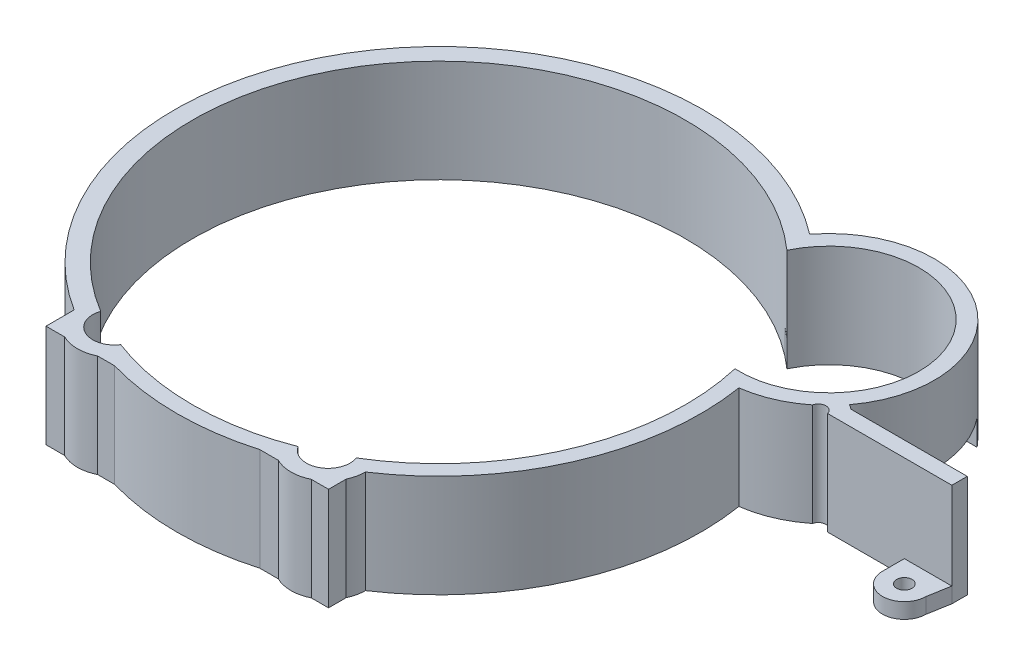
from build123d import *
from build123d.topology import SkipClean

# Parameters (mm, degrees)
CROQUIS1_R               = 51
CROQUIS1_R_2             = 48
SALIENTE_EXTRUIR1_DEPTH  = 20
CROQUIS2_W               = 46.227664069
CROQUIS2_H               = 115.031629194
CORTAR_EXTRUIR1_DEPTH    = 20
CROQUIS3_W               = 115.031629194
CROQUIS3_H               = 50
CORTAR_EXTRUIR2_DEPTH    = 20
CROQUIS4_R               = 20.5
CROQUIS4_R_2             = 17.5
SALIENTE_EXTRUIR2_DEPTH  = 20
CROQUIS5_W               = 28.18
CROQUIS5_H               = 3
SALIENTE_EXTRUIR3_DEPTH  = 20
CROQUIS6_W               = 111.479802907
CROQUIS6_H               = 36.253594441
CORTAR_EXTRUIR3_DEPTH    = 20
CORTAR_EXTRUIR4_START    = -20
CROQUIS7_R               = 48
CORTAR_EXTRUIR4_DEPTH    = 20
CROQUIS8_R               = 4.25
CORTAR_EXTRUIR5_DEPTH    = 20
CROQUIS9_R               = 7.25
CROQUIS9_R_2             = 4.25
SALIENTE_EXTRUIR4_DEPTH  = 20
CROQUIS10_W              = 2.531492225
CROQUIS10_H              = 7.290281387
CORTAR_EXTRUIR6_DEPTH    = 20
CROQUIS11_R              = 48
CORTAR_EXTRUIR7_DEPTH    = 20
SALIENTE_EXTRUIR5_DEPTH  = 3
CROQUIS13_R              = 4.25
CROQUIS13_R_2            = 2.5
SALIENTE_EXTRUIR6_DEPTH  = 3
CROQUIS14_R              = 2.5
CORTAR_EXTRUIR8_DEPTH    = 3
CROQUIS16_R              = 4.25
CORTAR_EXTRUIR9_DEPTH    = 20
CROQUIS17_R              = 7.25
CROQUIS17_R_2            = 4.25
SALIENTE_EXTRUIR7_DEPTH  = 20
CROQUIS18_R              = 48
CORTAR_EXTRUIR10_DEPTH   = 20
CROQUIS19_R              = 4.25
CROQUIS19_R_2            = 2.5
SALIENTE_EXTRUIR8_DEPTH  = 3
CROQUIS20_R              = 4.25
CROQUIS20_R_2            = 2.5
SALIENTE_EXTRUIR9_DEPTH  = 3
CROQUIS21_R              = 4.25
CROQUIS21_R_2            = 2.5
SALIENTE_EXTRUIR10_DEPTH = 3
SALIENTE_EXTRUIR11_DEPTH = 3
CROQUIS24_R              = 1.5
CORTAR_EXTRUIR12_DEPTH   = 20
SALIENTE_EXTRUIR12_DEPTH = 20
CROQUIS26_W              = 2.889817697
CROQUIS26_H              = 4.125131583
SALIENTE_EXTRUIR16_DEPTH = 20
CROQUIS29_W              = 44.739591713
CROQUIS29_H              = 0.826618845
SALIENTE_EXTRUIR17_DEPTH = 20
CROQUIS30_W              = 3.358230928
CROQUIS30_H              = 3.6
SALIENTE_EXTRUIR18_DEPTH = 20
CROQUIS31_R              = 20.5
CROQUIS31_R_2            = 17.5
SALIENTE_EXTRUIR20_DEPTH = 15
CORTAR_EXTRUIR14_DEPTH   = 15
CROQUIS33_R              = 17.5
CORTAR_EXTRUIR16_DEPTH   = 30
CROQUIS34_R              = 1.5
CORTAR_EXTRUIR17_DEPTH   = 30
SALIENTE_EXTRUIR21_DEPTH = 5
SALIENTE_EXTRUIR23_DEPTH = 20
CROQUIS39_R              = 2.5
CROQUIS39_R_2            = 1.5
SALIENTE_EXTRUIR24_DEPTH = 3


with BuildPart() as part:
    # Croquis1 → Saliente-Extruir1 (new body)
    with BuildSketch(Plane(origin=(0, 0, 0), x_dir=(1, 0, 0), z_dir=(0, 1, 0))):
        Circle(CROQUIS1_R)
        Circle(CROQUIS1_R_2, mode=Mode.SUBTRACT)
    extrude(amount=SALIENTE_EXTRUIR1_DEPTH)

    # Croquis2 → Cortar-Extruir1 (cut)
    with BuildSketch(Plane(origin=(0, 20, 0), x_dir=(1, 0, 0), z_dir=(0, 1, 0))):
        with Locations((-50.613832034, -0.410683976)):
            Rectangle(CROQUIS2_W, CROQUIS2_H)
    extrude(amount=-CORTAR_EXTRUIR1_DEPTH, mode=Mode.SUBTRACT)

    # Croquis3 → Cortar-Extruir2 (cut)
    with BuildSketch(Plane(origin=(0, 20, 0), x_dir=(1, 0, 0), z_dir=(0, 1, 0))):
        with Locations((13.717810151, 36)):
            Rectangle(CROQUIS3_W, CROQUIS3_H)
    extrude(amount=-CORTAR_EXTRUIR2_DEPTH, mode=Mode.SUBTRACT)

    # Croquis4 → Saliente-Extruir2 (add)
    with BuildSketch(Plane(origin=(0, 20, 0), x_dir=(1, 0, 0), z_dir=(0, 1, 0))):
        with Locations((47.61, 28.36)):
            Circle(CROQUIS4_R)
        with Locations((47.61, 28.36)):
            Circle(CROQUIS4_R_2, mode=Mode.SUBTRACT)
    extrude(amount=-SALIENTE_EXTRUIR2_DEPTH)

    # Croquis5 → Saliente-Extruir3 (add)
    with BuildSketch(Plane(origin=(0, 20, 0), x_dir=(1, 0, 0), z_dir=(0, 1, 0))):
        with Locations((73.42, 13.86)):
            Rectangle(CROQUIS5_W, CROQUIS5_H)
    extrude(amount=-SALIENTE_EXTRUIR3_DEPTH)

    # Croquis6 → Cortar-Extruir3 (cut)
    with BuildSketch(Plane(origin=(0, 20, 0), x_dir=(1, 0, 0), z_dir=(0, 1, 0))):
        with Locations((72.258145343, 33.486797221)):
            Rectangle(CROQUIS6_W, CROQUIS6_H)
    extrude(amount=-CORTAR_EXTRUIR3_DEPTH, mode=Mode.SUBTRACT)

    # Croquis7 → Cortar-Extruir4 (cut)
    with BuildSketch(Plane(origin=(0, 20, 0), x_dir=(1, 0, 0), z_dir=(0, 1, 0)).offset(CORTAR_EXTRUIR4_START)):
        Circle(CROQUIS7_R)
    extrude(amount=CORTAR_EXTRUIR4_DEPTH, mode=Mode.SUBTRACT)

    # Croquis8 → Cortar-Extruir5 (cut)
    with BuildSketch(Plane(origin=(0, 20, 0), x_dir=(1, 0, 0), z_dir=(0, 1, 0))):
        with Locations((-20.65, -42.501453964)):
            Circle(CROQUIS8_R)
    extrude(amount=-CORTAR_EXTRUIR5_DEPTH, mode=Mode.SUBTRACT)


with BuildPart() as cortar_extruir5_piece_1:
    # of the separate pieces the step leaves, piece 1, a body of its own (cortar_extruir5_pieces)
    add(part.part.solids().sort_by_distance((-20.396323621, 0, 46.74387642))[0])



with BuildPart() as cortar_extruir5_piece_2:
    # of the separate pieces the step leaves, piece 2, a body of its own (cortar_extruir5_pieces)
    add(part.part.solids().sort_by_distance((-27.5, 0, 42.950552965))[0])


with BuildPart() as cortar_extruir5_piece_1_1:
    add(cortar_extruir5_piece_1.part)

    add(cortar_extruir5_piece_2.part)  # Saliente-Extruir4 merges Cortar-Extruir5 piece 2
    # Croquis9 → Saliente-Extruir4 (add)
    with BuildSketch(Plane(origin=(0, 20, 0), x_dir=(1, 0, 0), z_dir=(0, 1, 0))):
        with Locations((-20.65, -42.501453964)):
            Circle(CROQUIS9_R)
        with Locations((-20.65, -42.501453964)):
            Circle(CROQUIS9_R_2, mode=Mode.SUBTRACT)
    extrude(amount=-SALIENTE_EXTRUIR4_DEPTH)

    # Croquis10 → Cortar-Extruir6 (cut)
    with BuildSketch(Plane(origin=(0, 20, 0), x_dir=(1, 0, 0), z_dir=(0, 1, 0))):
        with Locations((-28.765746113, -42.986594658)):
            Rectangle(CROQUIS10_W, CROQUIS10_H)
    extrude(amount=-CORTAR_EXTRUIR6_DEPTH, mode=Mode.SUBTRACT)

    # Croquis11 → Cortar-Extruir7 (cut)
    with BuildSketch(Plane(origin=(0, 20, 0), x_dir=(1, 0, 0), z_dir=(0, 1, 0))):
        Circle(CROQUIS11_R)
    extrude(amount=-CORTAR_EXTRUIR7_DEPTH, mode=Mode.SUBTRACT)

    # Croquis12 → Saliente-Extruir5 (add)
    with BuildSketch(Plane(origin=(0, 0, 0), x_dir=(-1, 0, 0), z_dir=(0, -1, 0))):
        with BuildLine():
            ThreePointArc((24.68481405, -41.166247768), (20.97668043, -43.173821676), (17.106663941, -44.848211211))
            ThreePointArc((17.106663941, -44.848211211), (21.875422733, -46.570955054), (24.9, -42.501453964))
            ThreePointArc((24.9, -42.501453964), (24.845858655, -41.825236437), (24.68481405, -41.166247768))
        make_face()
    extrude(amount=-SALIENTE_EXTRUIR5_DEPTH)

    # Croquis13 → Saliente-Extruir6 (add)
    with BuildSketch(Plane(origin=(0, 3, 0), x_dir=(1, 0, 0), z_dir=(0, 1, 0))):
        with Locations((-20.65, -42.501453964)):
            Circle(CROQUIS13_R)
        with Locations((-20.65, -42.501453964)):
            Circle(CROQUIS13_R_2, mode=Mode.SUBTRACT)
    extrude(amount=-SALIENTE_EXTRUIR6_DEPTH)

    # Croquis14 → Cortar-Extruir8 (cut)
    with BuildSketch(Plane(origin=(0, 3, 0), x_dir=(1, 0, 0), z_dir=(0, 1, 0))):
        with Locations((-20.65, -42.501453964)):
            Circle(CROQUIS14_R)
    extrude(amount=-CORTAR_EXTRUIR8_DEPTH, mode=Mode.SUBTRACT)

    # Croquis16 → Cortar-Extruir9 (cut)
    with BuildSketch(Plane(origin=(0, 20, 0), x_dir=(1, 0, 0), z_dir=(0, 1, 0))):
        with Locations((20.945604111, -42.498777258)):
            Circle(CROQUIS16_R)
    extrude(amount=-CORTAR_EXTRUIR9_DEPTH, mode=Mode.SUBTRACT)


with BuildPart() as cortar_extruir9_piece_1:
    # of the separate pieces the step leaves, piece 1, a body of its own (cortar_extruir9_pieces)
    add(cortar_extruir5_piece_1_1.part.solids().sort_by_distance((24.594436038, 0, 44.677888446))[0])



with BuildPart() as cortar_extruir9_piece_2:
    # of the separate pieces the step leaves, piece 2, a body of its own (cortar_extruir9_pieces)
    add(cortar_extruir5_piece_1_1.part.solids().sort_by_distance((-27.5, 0, 39.341453964))[0])


with BuildPart() as cortar_extruir9_piece_1_1:
    add(cortar_extruir9_piece_1.part)

    add(cortar_extruir9_piece_2.part)  # Saliente-Extruir7 merges Cortar-Extruir9 piece 2
    # Croquis17 → Saliente-Extruir7 (add)
    with BuildSketch(Plane(origin=(0, 20, 0), x_dir=(1, 0, 0), z_dir=(0, 1, 0))):
        with Locations((20.945604111, -42.498777258)):
            Circle(CROQUIS17_R)
        with Locations((20.945604111, -42.498777258)):
            Circle(CROQUIS17_R_2, mode=Mode.SUBTRACT)
    extrude(amount=-SALIENTE_EXTRUIR7_DEPTH)

    # Croquis18 → Cortar-Extruir10 (cut)
    with BuildSketch(Plane(origin=(0, 20, 0), x_dir=(1, 0, 0), z_dir=(0, 1, 0))):
        Circle(CROQUIS18_R)
    extrude(amount=-CORTAR_EXTRUIR10_DEPTH, mode=Mode.SUBTRACT)

    # Croquis19 → Saliente-Extruir8 (add)
    with BuildSketch(Plane(origin=(0, 0, 0), x_dir=(-1, 0, 0), z_dir=(0, -1, 0))):
        with Locations((-20.945604111, -42.498777258)):
            Circle(CROQUIS19_R)
        with Locations((-20.945604111, -42.498777258)):
            Circle(CROQUIS19_R_2, mode=Mode.SUBTRACT)
    extrude(amount=-SALIENTE_EXTRUIR8_DEPTH)

    # Croquis20 → Saliente-Extruir9 (add)
    with BuildSketch(Plane(origin=(0, 3, 0), x_dir=(1, 0, 0), z_dir=(0, 1, 0))):
        with Locations((-20.65, -42.501453964)):
            Circle(CROQUIS20_R)
        with Locations((-20.65, -42.501453964)):
            Circle(CROQUIS20_R_2, mode=Mode.SUBTRACT)
    extrude(amount=-SALIENTE_EXTRUIR9_DEPTH)



with BuildPart() as body_2:
    # Croquis21 → Saliente-Extruir10 (new body)
    with BuildSketch(Plane(origin=(0, 0, 0), x_dir=(-1, 0, 0), z_dir=(0, -1, 0))):
        with Locations((-82.51, 8.11)):
            Circle(CROQUIS21_R)
        with Locations((-82.51, 8.11)):
            Circle(CROQUIS21_R_2, mode=Mode.SUBTRACT)
    extrude(amount=-SALIENTE_EXTRUIR10_DEPTH)


with BuildPart() as cortar_extruir9_piece_1_2:
    add(cortar_extruir9_piece_1_1.part)

    add(body_2.part)  # Saliente-Extruir11 merges body 2
    # Croquis22 → Saliente-Extruir11 (add)
    with BuildSketch(Plane(origin=(0, 0, 0), x_dir=(-1, 0, 0), z_dir=(0, -1, 0))):
        with BuildLine():
            ThreePointArc((-86.76, 8.11), (-82.51, 12.36), (-78.26, 8.11))
            Line((-78.26, 8.11), (-78.26, 13.472892249))
            Line((-78.26, 13.472892249), (-87.51, 12.36))
            Line((-87.51, 12.36), (-86.76, 8.11))
        make_face()
    extrude(amount=-SALIENTE_EXTRUIR11_DEPTH)

    # Croquis24 → Cortar-Extruir12 (cut)
    with BuildSketch(Plane(origin=(0, 20, 0), x_dir=(1, 0, 0), z_dir=(0, 1, 0))):
        with Locations((61.852759443, 11.99829173)):
            Circle(CROQUIS24_R)
    extrude(amount=-CORTAR_EXTRUIR12_DEPTH, mode=Mode.SUBTRACT)

    # Croquis25 → Saliente-Extruir12 (add)
    with BuildSketch(Plane(origin=(0, 20, 0), x_dir=(1, 0, 0), z_dir=(0, 1, 0))):
        with BuildLine():
            Line((63.308495383, 12.36), (66.338198901, 12.36))
            ThreePointArc((66.338198901, 12.36), (60.899418012, 16.396148039), (57.620171016, 10.470157177))
            ThreePointArc((57.620171016, 10.470157177), (59.043129708, 11.344314734), (60.390213149, 12.331395823))
            ThreePointArc((60.390213149, 12.331395823), (61.838057573, 13.49821968), (63.308495383, 12.36))
        make_face()
    extrude(amount=-SALIENTE_EXTRUIR12_DEPTH)

    # Croquis26 → Saliente-Extruir16 (add)
    with BuildSketch(Plane(origin=(0, 20, 0), x_dir=(1, 0, 0), z_dir=(0, 1, 0))):
        with Locations((-26.055091152, -46.938888173)):
            Rectangle(CROQUIS26_W, CROQUIS26_H)
    extrude(amount=-SALIENTE_EXTRUIR16_DEPTH)

    # Croquis29 → Saliente-Extruir17 (add)
    with BuildSketch(Plane(origin=(0, 20, 0), x_dir=(1, 0, 0), z_dir=(0, 1, 0))):
        with Locations((-2.240386447, -48.588144542)):
            Rectangle(CROQUIS29_W, CROQUIS29_H)
    extrude(amount=-SALIENTE_EXTRUIR17_DEPTH)

    # Croquis30 → Saliente-Extruir18 (add)
    with BuildSketch(Plane(origin=(0, 20, 0), x_dir=(1, 0, 0), z_dir=(0, 1, 0))):
        with Locations((25.830604111, -47.201453964)):
            Rectangle(CROQUIS30_W, CROQUIS30_H)
    extrude(amount=-SALIENTE_EXTRUIR18_DEPTH)

    # Croquis31 → Saliente-Extruir20 (add)
    with BuildSketch(Plane(origin=(0, 20, 0), x_dir=(1, 0, 0), z_dir=(0, 1, 0))):
        with Locations((47.61, 28.36)):
            Circle(CROQUIS31_R)
        with Locations((47.61, 28.36)):
            Circle(CROQUIS31_R_2, mode=Mode.SUBTRACT)
    extrude(amount=-SALIENTE_EXTRUIR20_DEPTH)

    # Croquis32 → Cortar-Extruir14 (cut)
    with BuildSketch(Plane(origin=(0, 20, 0), x_dir=(1, 0, 0), z_dir=(0, 1, 0))):
        with BuildLine():
            Line((23.113679038, 42.068489887), (0, 0))
            Line((0, 0), (48, 0))
            ThreePointArc((48, 0), (41.312568268, 24.439142847), (23.113679038, 42.068489887))
        make_face()
    extrude(amount=-CORTAR_EXTRUIR14_DEPTH, mode=Mode.SUBTRACT)

    # Croquis33 → Cortar-Extruir16 (cut)
    with BuildSketch(Plane(origin=(0, 20, 0), x_dir=(1, 0, 0), z_dir=(0, 1, 0))):
        with Locations((47.61, 28.36)):
            Circle(CROQUIS33_R)
    extrude(amount=-CORTAR_EXTRUIR16_DEPTH, mode=Mode.SUBTRACT)

    # Croquis34 → Cortar-Extruir17 (cut)
    with BuildSketch(Plane(origin=(0, 20, 0), x_dir=(1, 0, 0), z_dir=(0, 1, 0))):
        with Locations((61.852759443, 11.99829173)):
            Circle(CROQUIS34_R)
    extrude(amount=-CORTAR_EXTRUIR17_DEPTH, mode=Mode.SUBTRACT)

    # Croquis35 → Saliente-Extruir21 (add)
    with BuildSketch(Plane(origin=(0, 5, 0), x_dir=(-1, 0, 0), z_dir=(0, -1, 0))):
        with BuildLine():
            Line((-31.83087451, 35.927641558), (-29.462116322, 37.894375596))
            ThreePointArc((-29.462116322, 37.894375596), (-45.627278328, 48.763892148), (-63.582711104, 41.21))
            Line((-63.582711104, 41.21), (-59.489709592, 41.21))
            ThreePointArc((-59.489709592, 41.21), (-44.327137109, 45.549322594), (-31.83087451, 35.927641558))
        make_face()
    extrude(amount=SALIENTE_EXTRUIR21_DEPTH)

    # Croquis38 → Saliente-Extruir23 (add)
    with SkipClean():  # the faces are left unmerged after this step: merging them gives an invalid solid
        with BuildSketch(Plane(origin=(0, 20, 0), x_dir=(1, 0, 0), z_dir=(0, 1, 0))):
            with BuildLine():
                Line((29.462116322, 37.894375596), (31.791623446, 38.317632896))
                Line((31.791623446, 38.317632896), (31.347956728, 40.841824731))
                ThreePointArc((31.347956728, 40.841824731), (-42.227686968, 29.454566568), (-27.5, -43.525843339))
                Line((-27.5, -43.525843339), (-27.5, -39.341453964))
                ThreePointArc((-27.5, -39.341453964), (-38.630374281, 28.490247154), (29.462116322, 37.894375596))
            make_face()
        extrude(amount=-SALIENTE_EXTRUIR23_DEPTH)

    # Croquis39 → Saliente-Extruir24 (add)
    # profile 1 of 3: a face of its own
    with SkipClean():  # the faces are left unmerged after this step: merging them gives an invalid solid
        with BuildSketch(Plane(origin=(0, 3, 0), x_dir=(1, 0, 0), z_dir=(0, 1, 0))):
            with Locations((-20.65, -42.501453964)):
                Circle(CROQUIS39_R)
            with Locations((-20.65, -42.501453964)):
                Circle(CROQUIS39_R_2, mode=Mode.SUBTRACT)
        # profile 2 of 3: a face of its own
        with BuildSketch(Plane(origin=(0, 3, 0), x_dir=(1, 0, 0), z_dir=(0, 1, 0))):
            with Locations((20.945604111, -42.498777258)):
                Circle(CROQUIS39_R)
            with Locations((20.945604111, -42.498777258)):
                Circle(CROQUIS39_R_2, mode=Mode.SUBTRACT)
        # profile 3 of 3: a face of its own
        with BuildSketch(Plane(origin=(0, 3, 0), x_dir=(1, 0, 0), z_dir=(0, 1, 0))):
            with Locations((82.51, 8.11)):
                Circle(CROQUIS39_R)
            with Locations((82.51, 8.11)):
                Circle(CROQUIS39_R_2, mode=Mode.SUBTRACT)
        extrude(amount=-SALIENTE_EXTRUIR24_DEPTH)


solid = cortar_extruir9_piece_1_2.part
